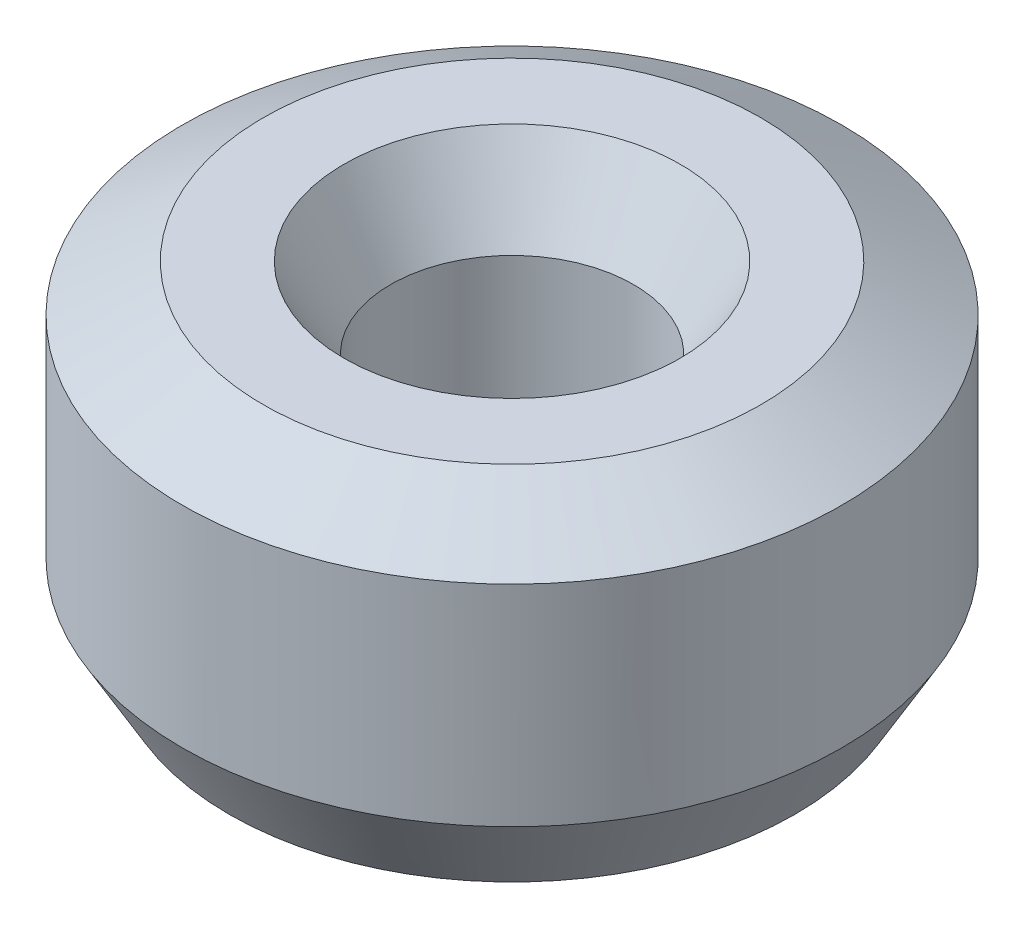
from build123d import *
from OCP.BRepFilletAPI import BRepFilletAPI_MakeChamfer

# Parameters (mm, degrees)
SKETCH1_R           = 12.5
BOSS_EXTRUDE1_DEPTH = 12.805926975
SKETCH2_R           = 4.606465617
CUT_EXTRUDE1_DEPTH  = 22.828691342
CHAMFER1_SIZE       = 1.770361928
CHAMFER1_SIZE2      = 3.066356807


with BuildPart() as part:
    # Sketch1 → Boss-Extrude1 (new body)
    with BuildSketch(Plane(origin=(0, 0, 0), x_dir=(1, 0, 0), z_dir=(0, 1, 0))):
        Circle(SKETCH1_R)
    extrude(amount=BOSS_EXTRUDE1_DEPTH)

    # Sketch2 → Cut-Extrude1 (cut, through all)
    with BuildSketch(Plane(origin=(0, 0, 0), x_dir=(1, 0, 0), z_dir=(0, 1, 0))):
        Circle(SKETCH2_R)
    extrude(amount=CUT_EXTRUDE1_DEPTH, mode=Mode.SUBTRACT)

    # Chamfer1: one chamfer whose edges measure the first distance from different faces: ONE call of the kernel's chamfer builder (chamfer() names one face for all edges)
    chamfer1_edges_1 = [part.edges().sort_by_distance(p)[0] for p in [
        (-4.606465617, 12.805926975, 0),
    ]]
    chamfer1_side_1 = [part.faces().sort_by_distance(p)[0] for p in [
        (-12.146446609, 12.805926975, 0),
    ]]
    chamfer1_edges_2 = [part.edges().sort_by_distance(p)[0] for p in [
        (-4.606465617, 0, 0),
    ]]
    chamfer1_side_2 = [part.faces().sort_by_distance(p)[0] for p in [
        (-4.606465617, 6.402963487, 0),
    ]]
    chamfer1_edges_3 = [part.edges().sort_by_distance(p)[0] for p in [
        (-12.5, 0, 0),
    ]]
    chamfer1_side_3 = [part.faces().sort_by_distance(p)[0] for p in [
        (-12.146446609, 0, 0),
    ]]
    chamfer1_edges_4 = [part.edges().sort_by_distance(p)[0] for p in [
        (-12.5, 12.805926975, 0),
    ]]
    chamfer1_side_4 = [part.faces().sort_by_distance(p)[0] for p in [
        (-12.5, 6.402963487, 0),
    ]]
    chamfer1 = BRepFilletAPI_MakeChamfer(part.part.solid().wrapped)
    for e in chamfer1_edges_1:
        chamfer1.Add(CHAMFER1_SIZE, CHAMFER1_SIZE2, e.wrapped, chamfer1_side_1[0].wrapped)  # the first distance lies on this face
    for e in chamfer1_edges_2:
        chamfer1.Add(CHAMFER1_SIZE, CHAMFER1_SIZE2, e.wrapped, chamfer1_side_2[0].wrapped)  # the first distance lies on this face
    for e in chamfer1_edges_3:
        chamfer1.Add(CHAMFER1_SIZE, CHAMFER1_SIZE2, e.wrapped, chamfer1_side_3[0].wrapped)  # the first distance lies on this face
    for e in chamfer1_edges_4:
        chamfer1.Add(CHAMFER1_SIZE, CHAMFER1_SIZE2, e.wrapped, chamfer1_side_4[0].wrapped)  # the first distance lies on this face
    add(Compound.cast(chamfer1.Shape()), mode=Mode.REPLACE)


solid = part.part
